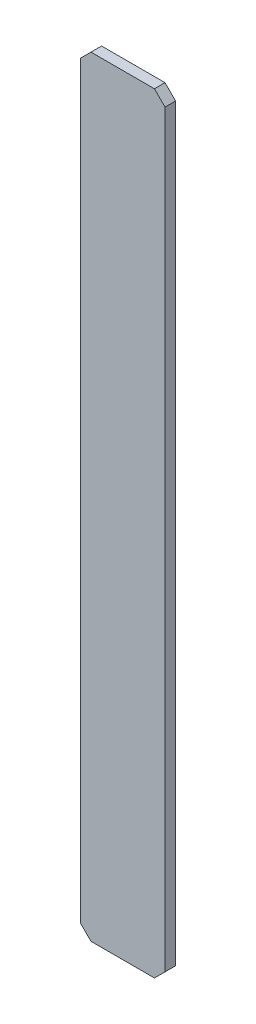
from build123d import *

# Parameters (mm, degrees)
SKETCH1_W           = 25.4
SKETCH1_H           = 3.175
BOSS_EXTRUDE1_DEPTH = 231.14
CHAMFER1_SIZE       = 3.175


with BuildPart() as part:
    # Sketch1 → Boss-Extrude1 (new body)
    with BuildSketch(Plane(origin=(0, 0, 0), x_dir=(1, 0, 0), z_dir=(0, 1, 0))):
        Rectangle(SKETCH1_W, SKETCH1_H)
    extrude(amount=BOSS_EXTRUDE1_DEPTH)

    # Chamfer1
    chamfer1_edges = [part.edges().sort_by_distance(p)[0] for p in [
        (12.7, 0, 0),
        (-12.7, 0, 0),
        (-12.7, 231.14, 0),
        (12.7, 231.14, 0),
    ]]
    chamfer(chamfer1_edges, length=CHAMFER1_SIZE)


solid = part.part
